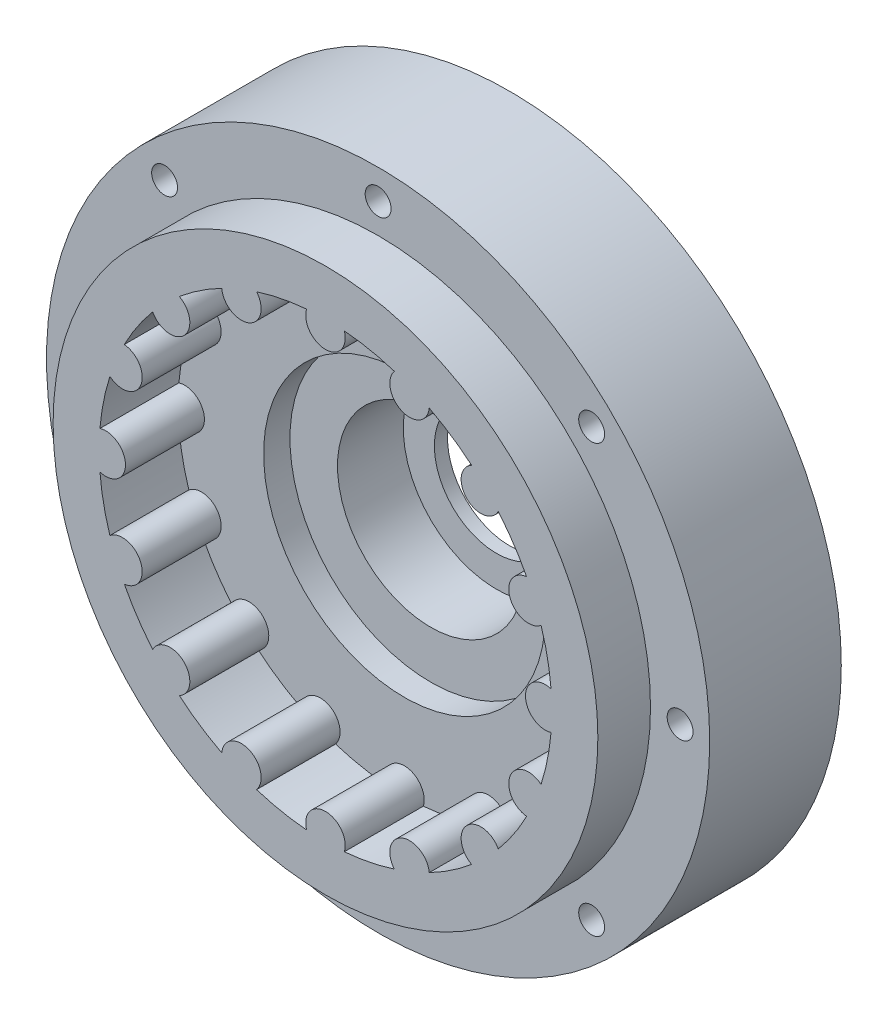
from build123d import *

# Parameters (mm, degrees)
SKETCH1_R             = 32.004
BOSS_EXTRUDE1_DEPTH   = 12.7
SKETCH2_OUTSIDE_W     = 84.29
SKETCH2_OUTSIDE_H     = 84.29
SKETCH2_OUTSIDE_R     = 32.004
SKETCH2_OUTSIDE_R_2   = 26.289
CUT_EXTRUDE1_DEPTH    = 2.54
SKETCH4_R             = 13.589
CUT_EXTRUDE3_DEPTH    = 2.54
SKETCH5_R             = 6
CUT_EXTRUDE4_DEPTH    = 46.897455616
M3X0_5_TAPPED_HOLE1_D = 2.5
SKETCH5_3_R           = 9
SKETCH5_3_R_2         = 6
CUT_EXTRUDE5_DEPTH    = 6.35
BOSS_EXTRUDE2_START   = 7.62
SKETCH8_R             = 26.289
SKETCH8_R_2           = 21.844
BOSS_EXTRUDE2_DEPTH   = 7.62
SKETCH3_R             = 1.905
BOSS_EXTRUDE3_DEPTH   = 7.62


with BuildPart() as part:
    # Sketch1 → Boss-Extrude1 (new body)
    with BuildSketch(Plane.XY):
        Circle(SKETCH1_R)
    extrude(amount=BOSS_EXTRUDE1_DEPTH)

    # Sketch2 outside → Cut-Extrude1 (cut)
    # profile 1 of 2: a face of its own
    with BuildSketch(Plane.XY.offset(12.7)):
        Rectangle(SKETCH2_OUTSIDE_W, SKETCH2_OUTSIDE_H)
        Circle(SKETCH2_OUTSIDE_R, mode=Mode.SUBTRACT)
    # profile 2 of 2: a face of its own
    with BuildSketch(Plane.XY.offset(12.7)):
        Circle(SKETCH2_OUTSIDE_R_2)
    extrude(amount=-CUT_EXTRUDE1_DEPTH, mode=Mode.SUBTRACT)

    # Sketch4 → Cut-Extrude3 (cut)
    with BuildSketch(Plane.XY.offset(10.16)):
        Circle(SKETCH4_R)
    extrude(amount=-CUT_EXTRUDE3_DEPTH, mode=Mode.SUBTRACT)

    # Sketch5 → Cut-Extrude4 (cut, through all)
    with BuildSketch(Plane.XY.offset(7.62)):
        Circle(SKETCH5_R)
    extrude(amount=-CUT_EXTRUDE4_DEPTH, mode=Mode.SUBTRACT)

    # M3x0.5 Tapped Hole1 (through all)
    with Locations(Plane.XY.offset(12.7)):
        with Locations((-20.609687798, 20.609687798), (0, 29.1465), (20.609687798, 20.609687798), (29.1465, 0), (20.609687798, -20.609687798), (0, -29.1465), (-20.609687798, -20.609687798), (-29.1465, 0)):
            Hole(M3X0_5_TAPPED_HOLE1_D / 2)

    # Sketch5<3> → Cut-Extrude5 (cut)
    with BuildSketch(Plane.XY.offset(7.62)):
        Circle(SKETCH5_3_R)
        Circle(SKETCH5_3_R_2, mode=Mode.SUBTRACT)
    extrude(amount=-CUT_EXTRUDE5_DEPTH, mode=Mode.SUBTRACT)

    # Sketch8 → Boss-Extrude2 (add)
    with BuildSketch(Plane.XY.offset(10.16).offset(BOSS_EXTRUDE2_START)):
        Circle(SKETCH8_R)
        Circle(SKETCH8_R_2, mode=Mode.SUBTRACT)
    extrude(amount=-BOSS_EXTRUDE2_DEPTH)

    # Sketch3 → Boss-Extrude3 (add)
    with BuildSketch(Plane.XY.offset(10.16)):
        with Locations((0, 21.209)):
            Circle(SKETCH3_R)
        with Locations((8.116332917, 19.594561005)):
            Circle(SKETCH3_R)
        with Locations((14.997027722, 14.997027722)):
            Circle(SKETCH3_R)
        with Locations((19.594561005, 8.116332917)):
            Circle(SKETCH3_R)
        with Locations((21.209, 0)):
            Circle(SKETCH3_R)
        with Locations((19.594561005, -8.116332917)):
            Circle(SKETCH3_R)
        with Locations((14.997027722, -14.997027722)):
            Circle(SKETCH3_R)
        with Locations((8.116332917, -19.594561005)):
            Circle(SKETCH3_R)
        with Locations((0, -21.209)):
            Circle(SKETCH3_R)
        with Locations((-8.116332917, -19.594561005)):
            Circle(SKETCH3_R)
        with Locations((-14.997027722, -14.997027722)):
            Circle(SKETCH3_R)
        with Locations((-19.594561005, -8.116332917)):
            Circle(SKETCH3_R)
        with Locations((-21.209, 0)):
            Circle(SKETCH3_R)
        with Locations((-19.594561005, 8.116332917)):
            Circle(SKETCH3_R)
        with Locations((-14.997027722, 14.997027722)):
            Circle(SKETCH3_R)
        with Locations((-8.116332917, 19.594561005)):
            Circle(SKETCH3_R)
    extrude(amount=BOSS_EXTRUDE3_DEPTH)


solid = part.part
